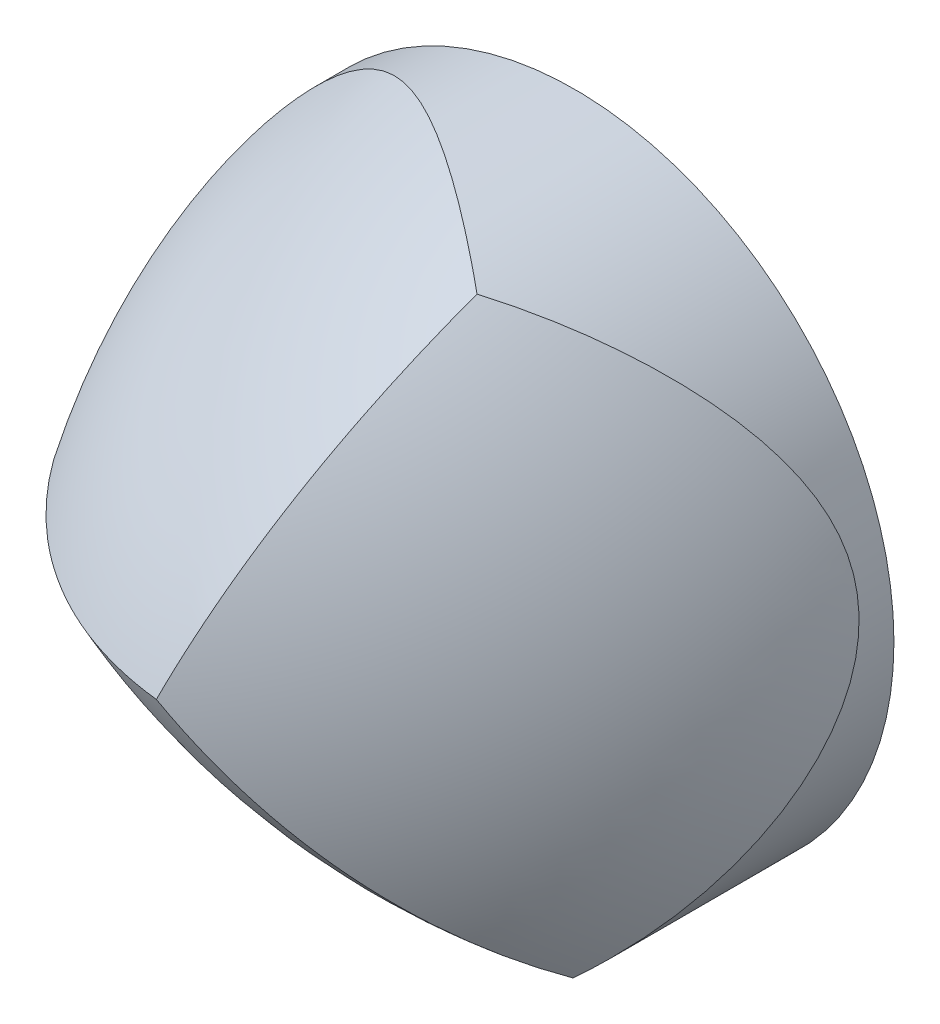
from build123d import *

# Parameters (mm, degrees)
SKETCH1_R           = 152.4
BOSS_EXTRUDE1_DEPTH = 300
CIRPATTERN1_COUNT   = 3


with BuildPart() as part:
    # Sketch1 → Boss-Extrude1 (new body)
    with BuildSketch(Plane.XY):
        Circle(SKETCH1_R)
    extrude(amount=BOSS_EXTRUDE1_DEPTH)

    # Sketch2 → Cut-Revolve1 (revolve, cut)
    with BuildSketch(Plane(origin=(0, 0, -90.9), x_dir=(-0.6427876096865012, 0.7660444431190102, 0), z_dir=(0.7660444431190102, 0.6427876096865012, 0))):
        with BuildLine():
            Line((-144.337567297, -293.6), (-144.337567297, -593.6))
            ThreePointArc((-144.337567297, -593.6), (465.662432703, 16.4), (-144.337567297, 626.4))
            Line((-144.337567297, 626.4), (-144.337567297, 326.4))
            ThreePointArc((-144.337567297, 326.4), (165.662432703, 16.4), (-144.337567297, -293.6))
        make_face()
    cut_revolve1 = revolve(axis=Axis((92.778399871, -110.568991361, -112.7), (0, 0, 1)), mode=Mode.SUBTRACT)

    # CirPattern1: Cut-Revolve1 ×3 about axis
    cirpattern1_axis = Axis((0, 0, 300), (0, 0, -1))
    for i in range(1, CIRPATTERN1_COUNT):
        add(cut_revolve1.rotate(cirpattern1_axis, i * 360 / CIRPATTERN1_COUNT), mode=Mode.SUBTRACT)


solid = part.part
